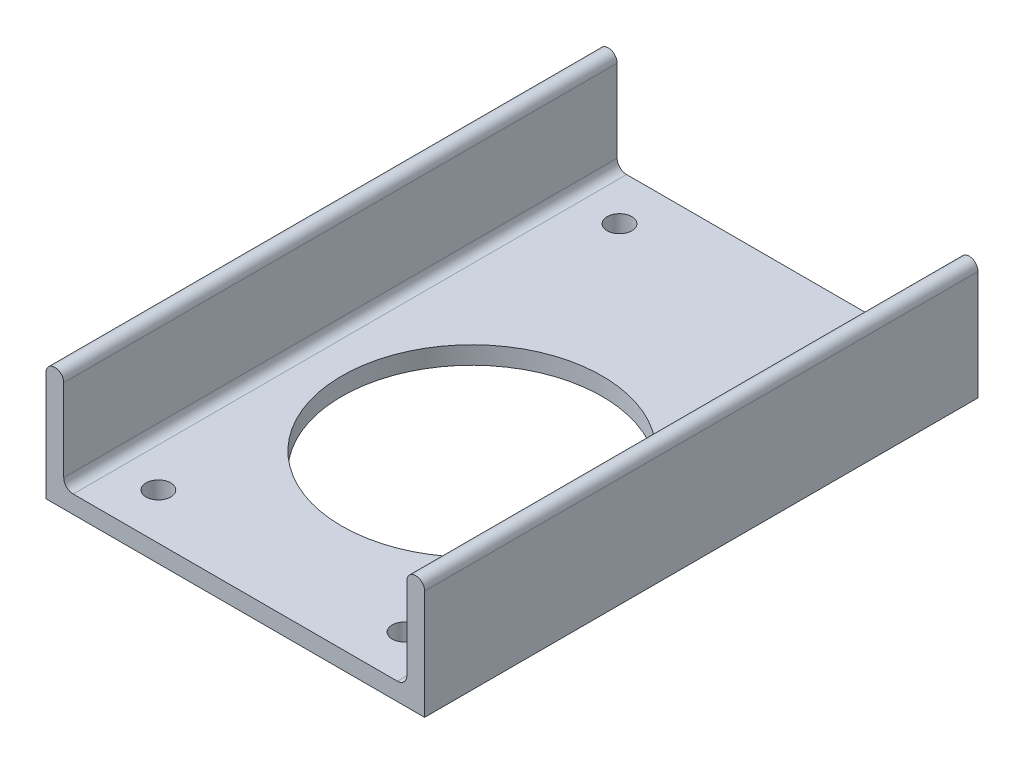
from build123d import *

# Parameters (mm, degrees)
EXTRUDE_THIN1_DEPTH  = 74.25436
FILLET1_RADIUS       = 2.38125
FILLET1_LENGTH       = 74.25436
FILLET2_R            = 2.54
MIRROR1_START        = -74.25436
MIRROR1_DEPTH        = 148.50872
M6_CLEARANCE_HOLE1_D = 6.6
SKETCH11_R           = 34.925
CUT_EXTRUDE4_DEPTH   = 94.929096319


# Read off the part's stored shape, not the designer's step: Mirror1
with BuildPart() as part:
    # Sketch4 → Extrude-Thin1 (new body)
    with BuildSketch(Plane.XY):
        Polygon((0, 0), (-50.8, 0), (-50.8, 31.75), (-46.0375, 31.75), (-46.0375, 4.7625), (0, 4.7625), align=None)
    extrude(amount=EXTRUDE_THIN1_DEPTH)

    # Fillet1: full round fillet: the end face becomes a half cylinder, R = half its width
    fillet1_face = Plane((-48.41875, 31.75, 37.12718), x_dir=(0, 0, -1), z_dir=(0, 1, 0))  # on the end face: x along it, z out of the body
    fillet1_slab = fillet1_face.offset(-FILLET1_RADIUS / 2) * Box(FILLET1_LENGTH, 2 * FILLET1_RADIUS, FILLET1_RADIUS, mode=Mode.PRIVATE)  # the body's end, R deep
    fillet1_round = Plane((-48.41875, 29.36875, 37.12718), x_dir=(0, 1, 0), z_dir=(0, 0, -1)) * Cylinder(FILLET1_RADIUS, FILLET1_LENGTH, mode=Mode.PRIVATE)  # its axis R under the face
    add(fillet1_slab - fillet1_round, mode=Mode.SUBTRACT)

    # Fillet2
    fillet2_edges = [part.edges().sort_by_distance(p)[0] for p in [
        (-46.0375, 4.7625, 37.12718),
    ]]
    fillet(fillet2_edges, radius=FILLET2_R)

    # Mirror1 outline → Mirror1 (add)
    with BuildSketch(Plane.XY.offset(MIRROR1_START)):
        with BuildLine():
            ThreePointArc((-46.0375, 29.36875), (-48.41875, 31.75), (-50.8, 29.36875))
            Line((-50.8, 29.36875), (-50.8, 0))
            Line((-50.8, 0), (50.8, 0))
            Line((50.8, 0), (50.8, 29.36875))
            ThreePointArc((50.8, 29.36875), (48.41875, 31.75), (46.0375, 29.36875))
            Line((46.0375, 29.36875), (46.0375, 7.3025))
            ThreePointArc((46.0375, 7.3025), (45.293551224, 5.506448776), (43.4975, 4.7625))
            Line((43.4975, 4.7625), (-43.4975, 4.7625))
            ThreePointArc((-43.4975, 4.7625), (-45.293551224, 5.506448776), (-46.0375, 7.3025))
            Line((-46.0375, 7.3025), (-46.0375, 29.36875))
        make_face()
    extrude(amount=MIRROR1_DEPTH)

    # M6 Clearance Hole1 (through all)
    with Locations(Plane(origin=(-33.02, 0, 61.87186), x_dir=(0, 0, -1), z_dir=(0, -1, 0))):
        with Locations((0, 0), (0, 66.04), (123.74372, 0), (123.74372, 66.04)):
            Hole(M6_CLEARANCE_HOLE1_D / 2)

    # Sketch11 → Cut-Extrude4 (cut, through all)
    with BuildSketch(Plane(origin=(0, 4.7625, 0), x_dir=(1, 0, 0), z_dir=(0, 1, 0))):
        with Locations(Location((0, -10.75436, 0), (0, 0, 270))):
            Circle(SKETCH11_R)
    extrude(amount=-CUT_EXTRUDE4_DEPTH, mode=Mode.SUBTRACT)


solid = part.part
